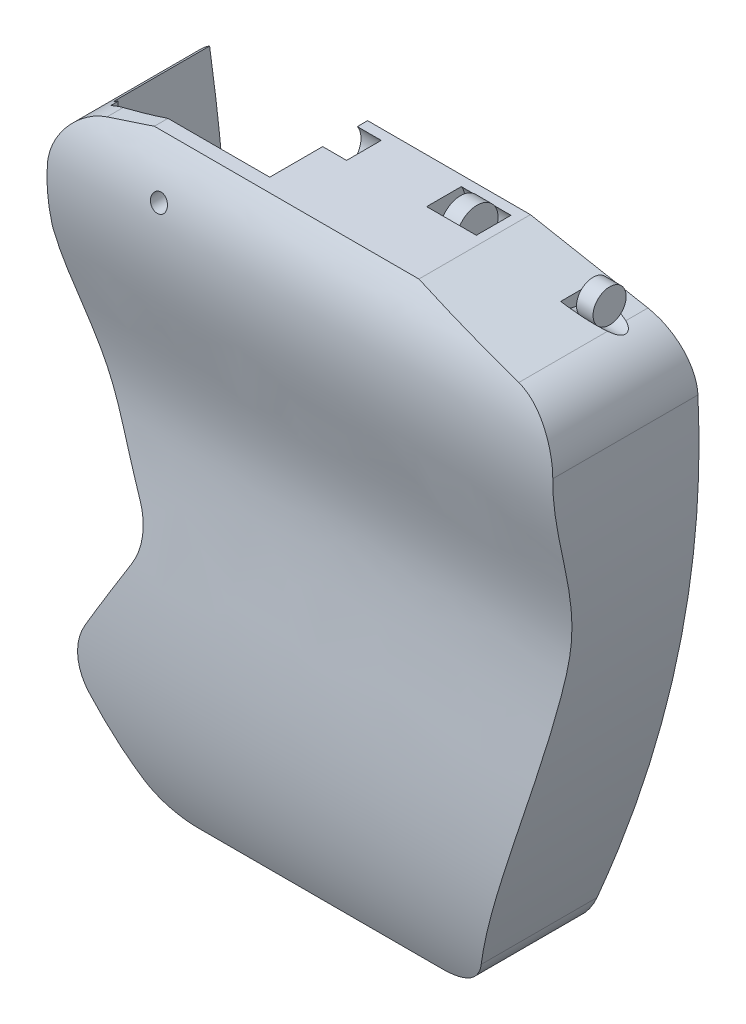
from build123d import *
from build123d.topology import SkipClean

# Parameters (mm, degrees)
SKETCH1_W                 = 92
SKETCH1_H                 = 110
BOSS_EXTRUDE1_DEPTH       = 20
SKETCH2_OUTSIDE_W         = 123.776
SKETCH2_OUTSIDE_H         = 141.776
CUT_EXTRUDE1_DEPTH        = 40
FILLET1_R                 = 10
CUT_EXTRUDE2_START        = -46
CUT_EXTRUDE2_DEPTH        = 91.589867
SKETCH4_R                 = 3
BOSS_EXTRUDE2_DEPTH       = 1.5
SKETCH5_R                 = 2.993852026
CUT_EXTRUDE3_DEPTH        = 3
SKETCH6_R                 = 3.803585259
BOSS_EXTRUDE4_DEPTH       = 1.5
SKETCH7_R                 = 3.803585259
CUT_EXTRUDE4_DEPTH        = 3
LPATTERN1_COUNT           = 3
LPATTERN1_PITCH           = 23.5
LPATTERN1_COPY_1_SKETCH_R = 3.803585259
LPATTERN1_COPY_1_DEPTH    = 3
LPATTERN1_COPY_2_SKETCH_R = 3.803585259
LPATTERN1_COPY_2_DEPTH    = 3
SKETCH8_R                 = 3.5
BOSS_EXTRUDE5_DEPTH       = 1.5
SKETCH10_R                = 3.5
CUT_EXTRUDE5_DEPTH        = 3
CUT_EXTRUDE6_DEPTH        = 3
CUT_EXTRUDE6_DEPTH_BACK   = 12
CUT_EXTRUDE7_START        = -40.5
CUT_EXTRUDE7_DEPTH        = 15
CUT_EXTRUDE8_DEPTH        = 12
CUT_EXTRUDE8_DEPTH_BACK   = 4
SKETCH14_W                = 19.049200383
SKETCH14_H                = 8.763065321
SKETCH15_R                = 1.5
CUT_EXTRUDE9_DEPTH        = 10
SKETCH17_R                = 2
CUT_EXTRUDE10_DEPTH       = 75.754141406
CUT_EXTRUDE11_DEPTH       = 17
SKETCH19_W                = 16
SKETCH19_H                = 22.952990068
CUT_EXTRUDE13_DEPTH       = 10
CUT_EXTRUDE14_START       = -13.172046
CUT_EXTRUDE14_DEPTH       = 13.172046
SKETCH22_R                = 1.5
CUT_EXTRUDE15_DEPTH       = 10
CUT_EXTRUDE16_START       = -22.95299
SKETCH23_W                = 29.049200383
SKETCH23_H                = 18.340713921
CUT_EXTRUDE16_DEPTH       = 22.95299
CUT_EXTRUDE17_DEPTH       = 10
CUT_EXTRUDE18_DEPTH       = 10
CUT_EXTRUDE18_DEPTH_BACK  = 30
SKETCH25_W                = 4.921107584
SKETCH25_H                = 19.957825199


# Read off the part's stored shape, not the designer's step: Cut-Extrude7
with BuildPart() as part:
    # Sketch1 → Boss-Extrude1 (new, symmetric)
    with BuildSketch(Plane.XY):
        Rectangle(SKETCH1_W, SKETCH1_H)
    extrude(amount=BOSS_EXTRUDE1_DEPTH, both=True)

    # Sketch2 outside → Cut-Extrude1 (cut)
    with BuildSketch(Plane.XY.offset(20)):
        Rectangle(SKETCH2_OUTSIDE_W, SKETCH2_OUTSIDE_H)
        with BuildLine():
            Line((-46, 51.5), (-30.763760712, 55))
            Line((-30.763760712, 55), (-12.520367804, 55))
            Line((-12.520367804, 55), (17.157541065, 55))
            Line((17.157541065, 55), (46, 48.5))
            add(Edge.make_bspline(
                [(46, 48.5), (44.008883803, -5.160299162), (24.34515962, -55)],
                knots=[0, 0, 0, 1, 1, 1], degree=2))
            Line((24.34515962, -55), (-32, -55))
            Line((-32, -55), (-46, -34.5))
            Line((-46, -34.5), (-32.692071489, -11.477003821))
            add(Edge.make_bspline(
                [(-46, 51.5), (-48.516108769, 17.716701006), (-32.692071489, -11.477003821)],
                knots=[0, 0, 0, 1, 1, 1], degree=2))
        make_face(mode=Mode.SUBTRACT)
    extrude(amount=-CUT_EXTRUDE1_DEPTH, mode=Mode.SUBTRACT)

    # Fillet1
    # the kernel refuses this fillet: 10 mm, written as the material it adds along each edge
    with BuildSketch(Plane(origin=(-32.692071489, -11.477003821, 20), x_dir=(-0.5004397819440652, -0.8657713466313011, 0), z_dir=(0, 0, -1))) as fillet1_piece_1:
        with BuildLine():
            CenterArc((5.452591906, 10), FILLET1_R, 214.042352117, 55.957647883)
            Line((-2.833648092, 4.401944381), (-2.999372892, 4.289983269))
            ThreePointArc((-2.999372892, 4.289983269), (-1.560691283, 2.108372642), (-0.170506844, -0.104534282))
            Line((-0.170506844, -0.104534282), (0, -0.2))
            Line((0, -0.2), (5.452591906, -0.2))
            Line((5.452591906, -0.2), (5.452591906, 0))
        make_face()
    extrude(amount=40)
    # the kernel refuses this fillet: 10 mm, written as the material it takes off along each edge
    with BuildSketch(Plane(origin=(-46, 33.306430433, -20), x_dir=(0, 1, 0), z_dir=(0, 0, 1))) as fillet1_2_piece_1:
        with BuildLine():
            CenterArc((0.395099009, -10), FILLET1_R, 90, 4.631442201)
            Line((-0.412360135, -0.032652824), (-0.428509318, 0.16669412))
            ThreePointArc((-0.428509318, 0.16669412), (-0.221982436, 0.183236403), (-0.015426231, 0.199404191))
            Line((-0.015426231, 0.199404191), (0, 0.2))
            Line((0, 0.2), (0.395099009, 0.2))
            Line((0.395099009, 0.2), (0.395099009, 0))
        make_face()
    extrude(amount=40, mode=Mode.SUBTRACT)
    with BuildSketch(Plane(origin=(-32, -55, 20), x_dir=(1, 0, 0), z_dir=(0, 0, -1))) as fillet1_2_piece_2:
        with BuildLine():
            CenterArc((FILLET1_R * 0.528018691445, -FILLET1_R), FILLET1_R, 90, 55.669782804)
            Line((-FILLET1_R * 0.297782290429, -FILLET1_R * 0.436038353842), (-FILLET1_R * 0.314298310066, -FILLET1_R * 0.424759120919))
            Line((-FILLET1_R * 0.314298310066, -FILLET1_R * 0.424759120919), (-FILLET1_R * 0.0105603738289, FILLET1_R * 0.02))
            Line((-FILLET1_R * 0.0105603738289, FILLET1_R * 0.02), (FILLET1_R * 0.528018691445, FILLET1_R * 0.02))
            Line((FILLET1_R * 0.528018691445, FILLET1_R * 0.02), (FILLET1_R * 0.528018691445, 0))
        make_face()
    extrude(amount=40, mode=Mode.SUBTRACT)
    with BuildSketch(Plane(origin=(-46, -34.5, 20), x_dir=(0.5639616461575321, -0.8258009818735301, 0), z_dir=(0, 0, -1))) as fillet1_2_piece_3:
        with BuildLine():
            CenterArc((FILLET1_R * 0.629237904975, -FILLET1_R), FILLET1_R, 90, 64.359317202)
            Line((-FILLET1_R * 0.272287592165, -FILLET1_R * 0.567274015102), (-FILLET1_R * 0.290318102108, -FILLET1_R * 0.558619495404))
            Line((-FILLET1_R * 0.290318102108, -FILLET1_R * 0.558619495404), (-FILLET1_R * 0.0125847580995, FILLET1_R * 0.02))
            Line((-FILLET1_R * 0.0125847580995, FILLET1_R * 0.02), (FILLET1_R * 0.629237904975, FILLET1_R * 0.02))
            Line((FILLET1_R * 0.629237904975, FILLET1_R * 0.02), (FILLET1_R * 0.629237904975, 0))
        make_face()
    extrude(amount=40, mode=Mode.SUBTRACT)
    with BuildSketch(Plane(origin=(24.34515962, -55, 20), x_dir=(0.35684113119082667, 0.9341650855659568, 0), z_dir=(0, 0, -1))) as fillet1_2_piece_4:
        with BuildLine():
            CenterArc((6.885081042, -9.999401322), FILLET1_R, 89.373044774, 69.720629903)
            Line((-2.456569813, -6.43099001), (-2.64340283, -6.359621784))
            Line((-2.64340283, -6.359621784), (-0.186833017, 0.071368226))
            Line((-0.186833017, 0.071368226), (-0.002181133, 0.199988106))
            ThreePointArc((-0.002181133, 0.199988106), (3.497249592, 0.219102955), (6.996691631, 0.199988026))
            Line((6.996691631, 0.199988026), (6.994503188, 0))
        make_face()
    extrude(amount=40, mode=Mode.SUBTRACT)
    with BuildSketch(Plane(origin=(-46, 51.5, 20), x_dir=(0.9746157254214927, 0.22388431780975063, 0), z_dir=(0, 0, -1))) as fillet1_2_piece_5:
        with BuildLine():
            CenterArc((FILLET1_R * 0.796329940043, FILLET1_R), FILLET1_R, 192.937280718, 77.062719282)
            Line((-FILLET1_R * 0.178285785378, FILLET1_R * 0.77611568219), (-FILLET1_R * 0.197778099887, FILLET1_R * 0.771637995834))
            Line((-FILLET1_R * 0.197778099887, FILLET1_R * 0.771637995834), (-FILLET1_R * 0.0159265988009, -FILLET1_R * 0.02))
            Line((-FILLET1_R * 0.0159265988009, -FILLET1_R * 0.02), (FILLET1_R * 0.796329940043, -FILLET1_R * 0.02))
            Line((FILLET1_R * 0.796329940043, -FILLET1_R * 0.02), (FILLET1_R * 0.796329940043, 0))
        make_face()
    extrude(amount=40, mode=Mode.SUBTRACT)
    with BuildSketch(Plane(origin=(46, 48.5, 20), x_dir=(-0.9755340277881126, 0.21984849471284032, 0), z_dir=(0, 0, -1))) as fillet1_2_piece_6:
        with BuildLine():
            CenterArc((8.417593189, -10), FILLET1_R, 90, 80.947719906)
            Line((-1.457858704, -8.426643743), (-1.655367742, -8.395176618))
            ThreePointArc((-1.655367742, -8.395176618), (-0.953998288, -4.17438027), (-0.196603043, 0.036704816))
            Line((-0.196603043, 0.036704816), (0, 0.2))
            Line((0, 0.2), (8.417593189, 0.2))
            Line((8.417593189, 0.2), (8.417593189, 0))
        make_face()
    extrude(amount=40, mode=Mode.SUBTRACT)

    # Sketch3 → Cut-Extrude2 (cut)
    with BuildSketch(Plane(origin=(0, 0, 0), x_dir=(0, 0, -1), z_dir=(1, 0, 0)).offset(CUT_EXTRUDE2_START)):
        with BuildLine():
            Line((10.402709964, 63.330267817), (23.820711351, 63.330267817))
            Line((23.820711351, 63.330267817), (23.820711351, -63.501792914))
            Line((23.820711351, -63.501792914), (12.319567305, -63.501792914))
            add(Edge.make_bspline(
                [(10.402709964, 63.330267817), (20.945826518, 0.059245663), (12.319567305, -63.501792914)],
                knots=[0, 0, 0, 1, 1, 1], degree=2))
        make_face()
        with BuildLine():
            Line((-8.487302086, 55), (-8.487302086, 68.441887393))
            Line((-8.487302086, 68.441887393), (-41.352438243, 68.441887393))
            Line((-41.352438243, 68.441887393), (-41.352438243, -63.501792914))
            Line((-41.352438243, -63.501792914), (-4.587433052, -63.501792914))
            Line((-4.587433052, -63.501792914), (-4.587433052, -55))
            add(Edge.make_bspline(
                [(-8.487302086, 55), (-19.028735026, 39.890175074), (-4.49502507, 21.449173684), (-6.964116658, -15.846755543), (-12.511275574, -36.535530216), (-4.587433052, -55)],
                knots=[0, 0, 0, 0, 0.433786415, 0.504536757, 1, 1, 1, 1], degree=3))
        make_face()
    extrude(amount=CUT_EXTRUDE2_DEPTH, mode=Mode.SUBTRACT)

    # Sketch4 → Boss-Extrude2 (add, symmetric)
    with BuildSketch(Plane(origin=(35, 0, 0), x_dir=(0, 0, -1), z_dir=(1, 0, 0))):
        with Locations((6.707560927, 52.850595192)):
            Circle(SKETCH4_R)
    extrude(amount=BOSS_EXTRUDE2_DEPTH, both=True)

    # Sketch5 → Cut-Extrude3 (cut)
    with BuildSketch(Plane(origin=(36.5, 0, 0), x_dir=(0, 0, -1), z_dir=(1, 0, 0))):
        with Locations((6.707560927, 52.850595192)):
            Circle(SKETCH5_R)
    cut_extrude3 = extrude(amount=CUT_EXTRUDE3_DEPTH, mode=Mode.SUBTRACT)

    # Mirror1: Cut-Extrude3 across plane
    add(cut_extrude3.mirror(Plane(origin=(35, 0, 0), x_dir=(0, 0, 1), z_dir=(1, 0, 0))), mode=Mode.SUBTRACT)

    # Sketch6 → Boss-Extrude4 (add, symmetric)
    with BuildSketch(Plane(origin=(11, 0, 0), x_dir=(0, 0, -1), z_dir=(1, 0, 0))):
        with Locations((6.707560927, 52.850595192)):
            Circle(SKETCH6_R)
    boss_extrude4 = extrude(amount=BOSS_EXTRUDE4_DEPTH, both=True)

    # Sketch7 → Cut-Extrude4 (cut)
    with BuildSketch(Plane.ZY.offset(-9.5)):
        with Locations((-6.707560927, 52.850595192)):
            Circle(SKETCH7_R)
    cut_extrude4 = extrude(amount=CUT_EXTRUDE4_DEPTH, mode=Mode.SUBTRACT)

    # Mirror2: Cut-Extrude4 across Plane2
    add(cut_extrude4.mirror(Plane(origin=(11, 0, 0), x_dir=(0, 0, -1), z_dir=(1, 0, 0))), mode=Mode.SUBTRACT)

    # LPattern1: Boss-Extrude4, Cut-Extrude4 ×3
    with Locations(*[(-i * LPATTERN1_PITCH, 0, 0) for i in range(1, LPATTERN1_COUNT)]):
        add(boss_extrude4)
        add(cut_extrude4, mode=Mode.SUBTRACT)

    # LPattern1 copy 1 sketch → LPattern1 copy 1 (cut)
    with BuildSketch(Plane(origin=(-11, 0, 0), x_dir=(0, 0, 1), z_dir=(1, 0, 0))):
        with Locations((-6.707560927, -52.850595192)):
            Circle(LPATTERN1_COPY_1_SKETCH_R)
    extrude(amount=LPATTERN1_COPY_1_DEPTH, mode=Mode.SUBTRACT)

    # LPattern1 copy 2 sketch → LPattern1 copy 2 (cut)
    with BuildSketch(Plane(origin=(-34.5, 0, 0), x_dir=(0, 0, 1), z_dir=(1, 0, 0))):
        with Locations((-6.707560927, -52.850595192)):
            Circle(LPATTERN1_COPY_2_SKETCH_R)
    extrude(amount=LPATTERN1_COPY_2_DEPTH, mode=Mode.SUBTRACT)

    # Sketch8 → Boss-Extrude5 (add, symmetric)
    with BuildSketch(Plane(origin=(-20.816774782, -36.013458134, 0), x_dir=(0, 0, 1), z_dir=(-0.5004397819440648, -0.8657713466313013, 0))):
        with Locations((-5.791138445, 23.560309468)):
            Circle(SKETCH8_R)
    extrude(amount=BOSS_EXTRUDE5_DEPTH, both=True)

    # Sketch10 → Cut-Extrude5 (cut)
    with BuildSketch(Plane(origin=(-20.066115109, -34.714801114, 0), x_dir=(0.8657713466313013, -0.5004397819440648, 0), z_dir=(0.5004397819440648, 0.8657713466313013, 0))):
        with Locations((-23.560309468, 5.791138445)):
            Circle(SKETCH10_R)
    cut_extrude5 = extrude(amount=CUT_EXTRUDE5_DEPTH, mode=Mode.SUBTRACT)

    # Mirror3: Cut-Extrude5 across plane
    add(cut_extrude5.mirror(Plane(origin=(-20.816774782, -36.013458134, 0), x_dir=(0, 0, 1), z_dir=(-0.5004397819440648, -0.8657713466313013, 0))), mode=Mode.SUBTRACT)

    # Sketch11 → Cut-Extrude6 (cut, two sides: drawn at the far end of the back side and taken through both)
    with SkipClean():  # the faces are left unmerged after this step: merging them gives an invalid solid
        with BuildSketch(Plane.ZY.offset(37.5).offset(-CUT_EXTRUDE6_DEPTH_BACK)):
            with BuildLine():
                Line((-6.707560927, 56.654180451), (2.883388278, 56.654180451))
                ThreePointArc((2.883388278, 56.654180451), (6.686973538, 52.850595192), (2.883388278, 49.047009932))
                Line((2.883388278, 49.047009932), (-6.707560927, 49.047009932))
                ThreePointArc((-6.707560927, 49.047009932), (-10.511146187, 52.850595192), (-6.707560927, 56.654180451))
            make_face()
        extrude(amount=CUT_EXTRUDE6_DEPTH + CUT_EXTRUDE6_DEPTH_BACK, mode=Mode.SUBTRACT)

    # Cut-Extrude7 outline → Cut-Extrude7 (cut)
    with SkipClean():  # the faces are left unmerged after this step: merging them gives an invalid solid
        with BuildSketch(Plane.YZ.offset(CUT_EXTRUDE7_START)):
            with BuildLine():
                Line((49.047009932, 5.817186247), (49.047009932, 2.883388278))
                ThreePointArc((49.047009932, 2.883388278), (50.009151998, 5.411917772), (52.408817787, 6.661230725))
                Line((52.408817787, 6.661230725), (52.408817787, 7.666615648))
                ThreePointArc((52.408817787, 7.666615648), (50.535239211, 7.092136077), (49.047009932, 5.817186247))
            make_face()
            with BuildLine():
                Line((49.047009932, -6.707560927), (49.047009932, -7.957134496))
                ThreePointArc((49.047009932, -7.957134496), (50.327025389, -9.815661695), (52.408817787, -10.686697474))
                Line((52.408817787, -10.686697474), (52.408817787, -10.485403374))
                ThreePointArc((52.408817787, -10.485403374), (50.009151998, -9.236090421), (49.047009932, -6.707560927))
            make_face()
        extrude(amount=CUT_EXTRUDE7_DEPTH, mode=Mode.SUBTRACT)

    # Sketch14 → Cut-Extrude8 (cut, two sides: drawn at the far end of the back side and taken through both)
    with BuildSketch(Plane.XY.offset(-6.707560927).offset(-CUT_EXTRUDE8_DEPTH_BACK)):
        with Locations((-31.852554672, 53.428542593)):
            Rectangle(SKETCH14_W, SKETCH14_H)
    extrude(amount=CUT_EXTRUDE8_DEPTH + CUT_EXTRUDE8_DEPTH_BACK, mode=Mode.SUBTRACT)

    # Sketch15 → Cut-Extrude9 (cut)
    with BuildSketch(Plane(origin=(0, 49.047009932, 0), x_dir=(1, 0, 0), z_dir=(0, 1, 0))):
        with Locations(Location((-33, 3.511146187, 0), (0, 0, 270))):
            Circle(SKETCH15_R)
    extrude(amount=-CUT_EXTRUDE9_DEPTH, mode=Mode.SUBTRACT)

    # Sketch17 → Cut-Extrude10 (cut, through all)
    with BuildSketch(Plane.XY):
        with Locations((-15, 0)):
            Circle(SKETCH17_R)
        with Locations((15, 0)):
            Circle(SKETCH17_R)
    extrude(amount=-CUT_EXTRUDE10_DEPTH, mode=Mode.SUBTRACT)

    # Sketch18 → Cut-Extrude11 (cut)
    with BuildSketch(Plane(origin=(0, 49.047009932, 0), x_dir=(1, 0, 0), z_dir=(0, 1, 0))):
        Polygon((-41.377154863, -5.292439073), (-40.5, -5.292439073), (-40.5, -5.817186247), (-25.5, -5.817186247), (-25.5, -5.292439073), (-22.32795448, -5.292439073), (-22.32795448, 10.707560927), (-41.377154863, 10.707560927), align=None)
    extrude(amount=-CUT_EXTRUDE11_DEPTH, mode=Mode.SUBTRACT)

    # Sketch19 → Cut-Extrude13 (cut)
    with BuildSketch(Plane.ZY.offset(22.32795448)):
        with Locations((-2.707560927, 43.523504966)):
            Rectangle(SKETCH19_W, SKETCH19_H)
    extrude(amount=-CUT_EXTRUDE13_DEPTH, mode=Mode.SUBTRACT)

    # Sketch21 → Cut-Extrude14 (cut)
    with BuildSketch(Plane.ZY.offset(25.5).offset(CUT_EXTRUDE14_START)):
        with BuildLine():
            Line((6.021432223, 55), (5.292439073, 55))
            Line((5.292439073, 55), (5.292439073, 32.047009932))
            Line((5.292439073, 32.047009932), (5.817186247, 32.047009932))
            Line((5.817186247, 32.047009932), (5.817186247, 49.047009932))
            ThreePointArc((5.817186247, 49.047009932), (7.092136077, 50.535239211), (7.666615648, 52.408817787))
            Line((7.666615648, 52.408817787), (6.661230725, 52.408817787))
            ThreePointArc((6.661230725, 52.408817787), (6.576073948, 53.762370037), (6.021432223, 55))
        make_face()
    extrude(amount=CUT_EXTRUDE14_DEPTH, mode=Mode.SUBTRACT)

    # Sketch22 → Cut-Extrude15 (cut)
    with BuildSketch(Plane(origin=(0, 0, 5.817186247), x_dir=(-1, 0, 0), z_dir=(0, 0, -1))):
        with Locations(Location((26.32795448, 47, 0), (0, 0, 90))):
            Circle(SKETCH22_R)
    extrude(amount=-CUT_EXTRUDE15_DEPTH, mode=Mode.SUBTRACT)

    # Sketch23 → Cut-Extrude16 (cut)
    with BuildSketch(Plane(origin=(0, 55, 0), x_dir=(1, 0, 0), z_dir=(0, 1, 0)).offset(CUT_EXTRUDE16_START)):
        with Locations((-26.852554672, 10.068684011)):
            Rectangle(SKETCH23_W, SKETCH23_H)
    extrude(amount=CUT_EXTRUDE16_DEPTH, mode=Mode.SUBTRACT)

    # Sketch24 → Cut-Extrude17 (cut)
    with SkipClean():  # the faces are left unmerged after this step: merging them gives an invalid solid
        with BuildSketch(Plane.ZY.offset(8)):
            with BuildLine():
                ThreePointArc((-9.845604872, 55), (-6.707560927, 49.047009932), (-3.569516983, 55))
                ThreePointArc((-3.569516983, 55), (-6.707560927, 56.654180451), (-9.845604872, 55))
            make_face()
        extrude(amount=CUT_EXTRUDE17_DEPTH, mode=Mode.SUBTRACT)

    # Sketch25 → Cut-Extrude18 (cut, two sides: drawn at the far end of the back side and taken through both)
    with SkipClean():  # the faces are left unmerged after this step: merging them gives an invalid solid
        with BuildSketch(Plane.ZY.offset(12.32795448).offset(-CUT_EXTRUDE18_DEPTH_BACK)):
            with Locations((-15.923536996, -1.800316096)):
                Rectangle(SKETCH25_W, SKETCH25_H)
        extrude(amount=CUT_EXTRUDE18_DEPTH + CUT_EXTRUDE18_DEPTH_BACK, mode=Mode.SUBTRACT)


solid = part.part
